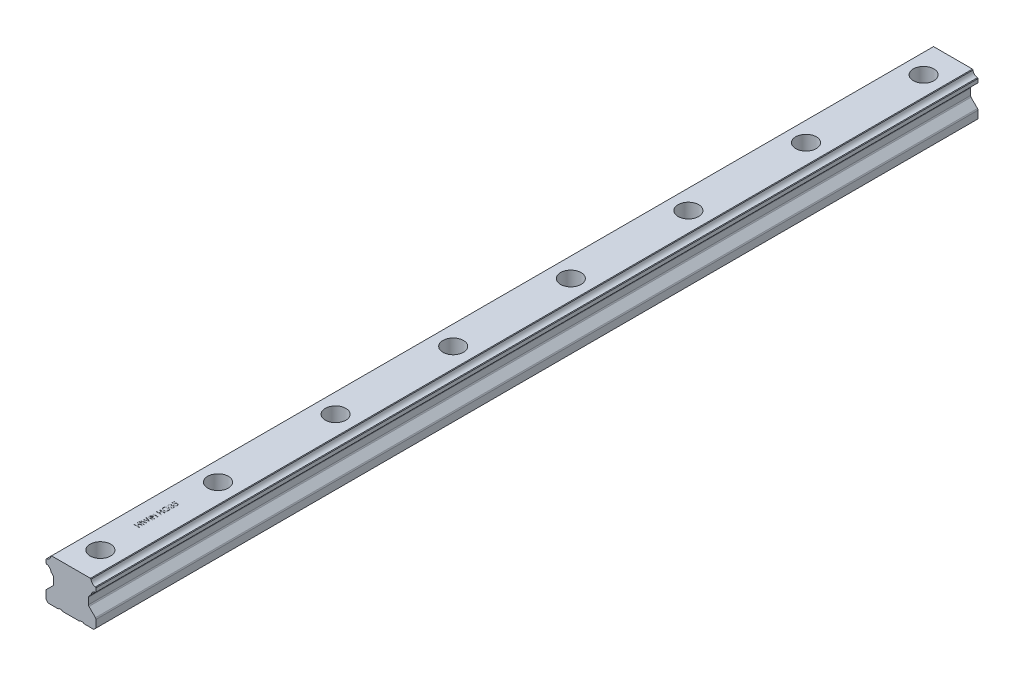
from build123d import *

# Parameters (mm, degrees)
EXTRUDE_1_DEPTH              = 600
HOLE_WIZARD_M8_1_D           = 9
HOLE_WIZARD_M8_1_CBORE_D     = 14
HOLE_WIZARD_M8_1_CBORE_DEPTH = 12
PATTERN_LINEAR_1_COUNT       = 8
PATTERN_LINEAR_1_PITCH       = 80
SKETCH_6_W                   = 3.5
SKETCH_6_H                   = 0.314102564
CUT_EXTRUDE_1_DEPTH          = 0.1


with BuildPart() as part:
    # 草图1 → 凸台-拉伸1 (new body)
    with BuildSketch(Plane.XY):
        with BuildLine():
            Line((-12.251471863, 11.889929766), (-16.648528137, 7.492873491))
            ThreePointArc((-16.648528137, 7.492873491), (-16.908655439, 7.103565472), (-17, 6.644345353))
            Line((-17, 6.644345353), (-17, 1.5))
            Line((-17, 1.5), (-15.5, 0))
            Line((-15.5, 0), (-8.75, 0))
            Line((-8.75, 0), (-8.25, 0.5))
            Line((-8.25, 0.5), (-6.35, 0.5))
            Line((-6.35, 0.5), (-5.85, 0))
            Line((-5.85, 0), (5.85, 0))
            Line((5.85, 0), (6.35, 0.5))
            Line((6.35, 0.5), (8.25, 0.5))
            Line((8.25, 0.5), (8.75, 0))
            Line((8.75, 0), (15.5, 0))
            Line((15.5, 0), (17, 1.5))
            Line((17, 1.5), (17, 6.644345353))
            ThreePointArc((17, 6.644345353), (16.908655439, 7.103565472), (16.648528137, 7.492873491))
            Line((16.648528137, 7.492873491), (12.251471863, 11.889929766))
            ThreePointArc((12.251471863, 11.889929766), (11.991344561, 12.279237784), (11.9, 12.738457903))
            Line((11.9, 12.738457903), (11.9, 17.141522369))
            ThreePointArc((11.9, 17.141522369), (11.991344561, 17.600742488), (12.251471863, 17.990050506))
            Line((12.251471863, 17.990050506), (13.625943381, 19.364522025))
            ThreePointArc((13.625943381, 19.364522025), (14.569476554, 21.429523446), (16.634477975, 22.373056619))
            Line((16.634477975, 22.373056619), (17, 22.738578644))
            Line((17, 22.738578644), (17, 25.251421356))
            Line((17, 25.251421356), (16.622602149, 25.628819207))
            ThreePointArc((16.622602149, 25.628819207), (14.569476554, 26.571476554), (13.626819207, 28.624602149))
            Line((13.626819207, 28.624602149), (13.251421356, 29))
            Line((13.251421356, 29), (-13.251421356, 29))
            Line((-13.251421356, 29), (-13.626819207, 28.624602149))
            ThreePointArc((-13.626819207, 28.624602149), (-14.569476554, 26.571476554), (-16.622602149, 25.628819207))
            Line((-16.622602149, 25.628819207), (-17, 25.251421356))
            Line((-17, 25.251421356), (-17, 22.738578644))
            Line((-17, 22.738578644), (-16.634477975, 22.373056619))
            ThreePointArc((-16.634477975, 22.373056619), (-14.569476554, 21.429523446), (-13.625943381, 19.364522025))
            Line((-13.625943381, 19.364522025), (-12.251471863, 17.990050506))
            ThreePointArc((-12.251471863, 17.990050506), (-11.991344561, 17.600742488), (-11.9, 17.141522369))
            Line((-11.9, 17.141522369), (-11.9, 12.738457903))
            ThreePointArc((-11.9, 12.738457903), (-11.991344561, 12.279237784), (-12.251471863, 11.889929766))
        make_face()
    extrude(amount=-EXTRUDE_1_DEPTH)

    # M8 六角凹头螺钉的柱形沉头孔1 (through all)
    with Locations(Plane(origin=(-5.47708742, 29, -56.116248257), x_dir=(-1, 0, 0), z_dir=(0, 1, 0))):
        with Locations((-5.47708742, 36.116248257)):
            hole_wizard_m8_1 = CounterBoreHole(HOLE_WIZARD_M8_1_D / 2, HOLE_WIZARD_M8_1_CBORE_D / 2, HOLE_WIZARD_M8_1_CBORE_DEPTH)

    # 阵列(线性)1: M8 六角凹头螺钉的柱形沉头孔1 ×8
    with Locations(*[(0, 0, -i * PATTERN_LINEAR_1_PITCH) for i in range(1, PATTERN_LINEAR_1_COUNT)]):
        add(hole_wizard_m8_1, mode=Mode.SUBTRACT)

    # 草图6 → 切除-拉伸1 (cut)
    with BuildSketch(Plane(origin=(0, 29, 0), x_dir=(1, 0, 0), z_dir=(0, 1, 0))):
        Polygon((-3.5, 46.403846154), (-3.5, 46.717948718), (-2.064102564, 46.717948718), (-2.064102564, 48.512820513), (-3.5, 48.512820513), (-3.5, 48.826923077), (0, 48.826923077), (0, 48.512820513), (-1.705128205, 48.512820513), (-1.705128205, 46.717948718), (0, 46.717948718), (0, 46.403846154), align=None)
        with Locations((-1.75, 49.881410256)):
            Rectangle(SKETCH_6_W, SKETCH_6_H)
        Polygon((-3.5, 50.576923077), (-3.5, 50.901542468), (-0.933193109, 51.586538462), (-3.5, 52.605268429), (-3.5, 52.650841346), (-0.950721154, 53.650641026), (-3.5, 54.339142628), (-3.5, 54.66025641), (0, 53.716546474), (0, 53.671674679), (-2.676883013, 52.618589744), (0, 51.552884615), (0, 51.508012821), align=None)
        with Locations((-1.75, 55.625)):
            Rectangle(SKETCH_6_W, SKETCH_6_H)
        Polygon((0, 56.544871795), (-3.5, 56.544871795), (-3.5, 56.610777244), (-0.745292468, 58.923076923), (-3.5, 58.923076923), (-3.5, 59.237179487), (0, 59.237179487), (0, 59.165665064), (-2.748397436, 56.858974359), (0, 56.858974359), align=None)
        Polygon((-3.5, 61.480769231), (-3.5, 61.794871795), (-2.064102564, 61.794871795), (-2.064102564, 63.58974359), (-3.5, 63.58974359), (-3.5, 63.903846154), (0, 63.903846154), (0, 63.58974359), (-1.705128205, 63.58974359), (-1.705128205, 61.794871795), (0, 61.794871795), (0, 61.480769231), align=None)
        with BuildLine():
            Line((-2.902644231, 68.076923077), (-2.647435897, 67.807692308))
            add(Edge.make_bspline(
                [(-2.647435897, 67.807692308), (-2.69328212, 67.758983227), (-2.783881335, 67.662726562), (-2.901244074, 67.50552662), (-3.002777003, 67.342170767), (-3.084772592, 67.172394867), (-3.149094254, 67.000650867), (-3.195850217, 66.829891913), (-3.225460377, 66.661223615), (-3.229016796, 66.549059313), (-3.230769231, 66.493790064)],
                knots=[0, 0, 0, 0, 1.089067066, 2.152164705, 3.18986567, 4.218445106, 5.218487318, 6.173592265, 7.100032889, 8, 8, 8, 8], degree=3))
            add(Edge.make_bspline(
                [(-3.230769231, 66.493790064), (-3.230355625, 66.459875364), (-3.229529486, 66.392133924), (-3.218985271, 66.29151198), (-3.203820407, 66.191945342), (-3.181878529, 66.093621968), (-3.15406947, 65.99635068), (-3.119284004, 65.900469793), (-3.078728771, 65.805800421), (-3.031866252, 65.713234402), (-2.980386575, 65.623493669), (-2.923337414, 65.538737672), (-2.862550889, 65.458421211), (-2.796491613, 65.384072004), (-2.725807311, 65.31519549), (-2.651770944, 65.250524789), (-2.572926872, 65.191265211), (-2.489599321, 65.138479571), (-2.403726867, 65.090811977), (-2.316037795, 65.049619777), (-2.227346143, 65.013809823), (-2.136984078, 64.986535862), (-2.045883197, 64.963434988), (-1.953566086, 64.947353752), (-1.859791669, 64.938257435), (-1.796993971, 64.936686944), (-1.765424679, 64.935897436)],
                knots=[0, 0, 0, 0, 1.028150113, 2.053633673, 3.06513288, 4.081487945, 5.106702018, 6.131327874, 7.172780699, 8.228344599, 9.276313556, 10.308389736, 11.324843658, 12.329040066, 13.321460474, 14.316307835, 15.308626991, 16.309440696, 17.305625405, 18.28535951, 19.246194545, 20.203493668, 21.145557131, 22.095268976, 23.042464743, 24, 24, 24, 24], degree=3))
            add(Edge.make_bspline(
                [(-1.765424679, 64.935897436), (-1.733154018, 64.936653631), (-1.668700816, 64.938163957), (-1.572504414, 64.947817154), (-1.477747832, 64.965772364), (-1.384282029, 64.989584114), (-1.291920993, 65.019856789), (-1.20076111, 65.057049303), (-1.110811241, 65.101355435), (-1.022964324, 65.152526704), (-0.937464192, 65.209036172), (-0.856251713, 65.271187356), (-0.780271995, 65.339084893), (-0.708415252, 65.411483836), (-0.641134974, 65.489043832), (-0.579242122, 65.572517364), (-0.521779643, 65.660735956), (-0.469378807, 65.753738745), (-0.42257144, 65.850542725), (-0.38094723, 65.949799156), (-0.346667976, 66.051827058), (-0.31872985, 66.156089724), (-0.295829559, 66.262463002), (-0.281097077, 66.371486803), (-0.270406246, 66.482359512), (-0.269624576, 66.557098144), (-0.269230769, 66.594751603)],
                knots=[0, 0, 0, 0, 0.935915162, 1.869274651, 2.799799983, 3.730201895, 4.664668062, 5.616159355, 6.583070886, 7.570012957, 8.562524459, 9.553461134, 10.53281078, 11.515274572, 12.509912756, 13.507571325, 14.526460018, 15.561318395, 16.601025881, 17.643204557, 18.680545676, 19.719612342, 20.772381578, 21.833430283, 22.908478249, 24, 24, 24, 24], degree=3))
            add(Edge.make_bspline(
                [(-0.269230769, 66.594751603), (-0.270178952, 66.640130135), (-0.272040863, 66.729238255), (-0.286546735, 66.860222075), (-0.309173205, 66.986034693), (-0.342412256, 67.106266531), (-0.384484705, 67.221353926), (-0.436513285, 67.330872414), (-0.497950569, 67.435124408), (-0.567552463, 67.533658668), (-0.645100929, 67.624132689), (-0.728035637, 67.706474768), (-0.817431068, 67.77785339), (-0.911954918, 67.840400707), (-1.012511326, 67.892097951), (-1.118540888, 67.934543829), (-1.230109213, 67.967076285), (-1.307200733, 67.980431374), (-1.346153846, 67.987179487)],
                knots=[0, 0, 0, 0, 1.130199668, 2.219330667, 3.279027493, 4.311506524, 5.322739849, 6.327972234, 7.327472899, 8.33386792, 9.329086447, 10.29244429, 11.240784345, 12.174119183, 13.111530729, 14.052100829, 15.015757696, 16, 16, 16, 16], degree=3))
            Line((-1.346153846, 67.987179487), (-1.346153846, 66.820512821))
            Line((-1.346153846, 66.820512821), (-1.705128205, 66.820512821))
            Line((-1.705128205, 66.820512821), (-1.705128205, 68.301282051))
            add(Edge.make_bspline(
                [(-1.705128205, 68.301282051), (-1.638220716, 68.299576203), (-1.507270675, 68.296237549), (-1.316300404, 68.272818634), (-1.13592871, 68.235002122), (-0.965965639, 68.18334181), (-0.806652046, 68.116466529), (-0.65782618, 68.035094001), (-0.520449499, 67.93792188), (-0.393400495, 67.828411438), (-0.280071283, 67.705511481), (-0.180465345, 67.572542861), (-0.09656273, 67.429285892), (-0.028302067, 67.275876085), (0.024971927, 67.112815651), (0.062743504, 66.939727272), (0.085373467, 66.756845671), (0.088264847, 66.631508994), (0.08974359, 66.567407853)],
                knots=[0, 0, 0, 0, 1.140356446, 2.231883559, 3.274166699, 4.278491846, 5.25512956, 6.21435461, 7.1637429, 8.11826594, 9.068280886, 10.0076534, 10.945064095, 11.891975133, 12.864533718, 13.863980011, 14.907571808, 16, 16, 16, 16], degree=3))
            add(Edge.make_bspline(
                [(0.08974359, 66.567407853), (0.089174469, 66.527897717), (0.088051978, 66.449970996), (0.080074631, 66.334880068), (0.067794054, 66.222962448), (0.049248931, 66.114234439), (0.026534277, 66.008296097), (-0.002552442, 65.905676512), (-0.036221141, 65.80598477), (-0.074516815, 65.709066784), (-0.118888472, 65.615802237), (-0.168198111, 65.52577572), (-0.222191472, 65.438489595), (-0.281802318, 65.35453843), (-0.346584778, 65.273484808), (-0.416668697, 65.195851364), (-0.491839816, 65.121203486), (-0.545218826, 65.074443023), (-0.572115385, 65.05088141)],
                knots=[0, 0, 0, 0, 1.107784379, 2.184907829, 3.233506516, 4.263428166, 5.276301166, 6.270063455, 7.25232949, 8.225834625, 9.190232166, 10.146266622, 11.1027726, 12.066435141, 13.031522626, 14.010570082, 14.99756817, 16, 16, 16, 16], degree=3))
            add(Edge.make_bspline(
                [(-0.572115385, 65.05088141), (-0.614786038, 65.016695478), (-0.699419055, 64.948891066), (-0.835018999, 64.861612909), (-0.975420859, 64.787211506), (-1.121015488, 64.726843684), (-1.271666701, 64.679705598), (-1.427181992, 64.645899345), (-1.587761622, 64.626092056), (-1.696426887, 64.623238518), (-1.751402244, 64.621794872)],
                knots=[0, 0, 0, 0, 1.023165419, 2.029347347, 3.013907458, 3.994755782, 4.975994455, 5.96558838, 6.970761222, 8, 8, 8, 8], degree=3))
            add(Edge.make_bspline(
                [(-1.751402244, 64.621794872), (-1.792568496, 64.62232711), (-1.874377804, 64.623384821), (-1.99583511, 64.636210339), (-2.115135808, 64.654611751), (-2.232182344, 64.681658827), (-2.347053012, 64.715755013), (-2.45980069, 64.758308794), (-2.570493643, 64.807852572), (-2.67836343, 64.865442289), (-2.782003044, 64.929511026), (-2.880905313, 64.999118682), (-2.973467332, 65.074802367), (-3.059903521, 65.156782462), (-3.141494975, 65.243406392), (-3.216537375, 65.336492693), (-3.286205011, 65.434631029), (-3.349159221, 65.538582169), (-3.405727075, 65.6467058), (-3.455315154, 65.758766886), (-3.496298775, 65.874724704), (-3.531072472, 65.993712261), (-3.556787635, 66.11662974), (-3.575436374, 66.242585283), (-3.588196976, 66.372235393), (-3.589223231, 66.459871423), (-3.58974359, 66.504306891)],
                knots=[0, 0, 0, 0, 1.00895651, 2.005089799, 2.991467152, 3.967318338, 4.948153826, 5.927364234, 6.919980553, 7.91976625, 8.923240147, 9.905815003, 10.88314567, 11.851989312, 12.825009789, 13.798721852, 14.781296708, 15.773896486, 16.776076962, 17.771600213, 18.775744723, 19.78957137, 20.808953803, 21.851964491, 22.910847925, 24, 24, 24, 24], degree=3))
            add(Edge.make_bspline(
                [(-3.58974359, 66.504306891), (-3.589164098, 66.540545135), (-3.588015034, 66.612401313), (-3.580050386, 66.719327046), (-3.567426505, 66.82460006), (-3.550199718, 66.92837645), (-3.526736028, 67.030302816), (-3.498657743, 67.130669522), (-3.46596592, 67.229622058), (-3.426977074, 67.326850307), (-3.382723449, 67.423008023), (-3.332910027, 67.518629864), (-3.276685022, 67.61338911), (-3.213881487, 67.707450091), (-3.145578069, 67.801405949), (-3.069821245, 67.893770591), (-2.989598489, 67.986773536), (-2.931916305, 68.04657535), (-2.902644231, 68.076923077)],
                knots=[0, 0, 0, 0, 0.985871117, 1.954866573, 2.915460327, 3.869826059, 4.81536089, 5.759505086, 6.70452669, 7.649098992, 8.607881297, 9.583363685, 10.581137262, 11.603961102, 12.659522466, 13.73993555, 14.853081303, 16, 16, 16, 16], degree=3))
        make_face()
        with BuildLine():
            Line((-2.692307692, 69.153846154), (-2.692307692, 68.83974359))
            add(Edge.make_bspline(
                [(-2.692307692, 68.83974359), (-2.727540176, 68.84825314), (-2.796416801, 68.864888616), (-2.894824062, 68.899586189), (-2.987947583, 68.937385445), (-3.074043657, 68.982774549), (-3.154842559, 69.032283303), (-3.228511684, 69.089006025), (-3.296924649, 69.150325748), (-3.357637887, 69.218150697), (-3.412615616, 69.289279358), (-3.459490673, 69.364713978), (-3.499814826, 69.442936872), (-3.533035058, 69.524490005), (-3.558060582, 69.609616177), (-3.576217387, 69.6975458), (-3.588008502, 69.7885093), (-3.589159265, 69.850256891), (-3.58974359, 69.881610577)],
                knots=[0, 0, 0, 0, 1.162005537, 2.271625781, 3.343758855, 4.383309926, 5.390229558, 6.379919256, 7.361854164, 8.333198761, 9.295911338, 10.242430842, 11.177959212, 12.116337295, 13.062827104, 14.020064771, 14.994644689, 16, 16, 16, 16], degree=3))
            add(Edge.make_bspline(
                [(-3.58974359, 69.881610577), (-3.588364359, 69.927293319), (-3.585635984, 70.01766233), (-3.560721548, 70.150425377), (-3.521296415, 70.278452196), (-3.466822688, 70.400341444), (-3.399635375, 70.513559876), (-3.319670638, 70.614296063), (-3.228471337, 70.701184574), (-3.127738772, 70.774078952), (-3.020083263, 70.831153951), (-2.909283106, 70.873240324), (-2.795601134, 70.898862005), (-2.718843855, 70.902182562), (-2.680388622, 70.903846154)],
                knots=[0, 0, 0, 0, 1.083050992, 2.142477498, 3.193116406, 4.255571735, 5.30263384, 6.308962982, 7.297363603, 8.282367274, 9.249857812, 10.179914175, 11.08814088, 12, 12, 12, 12], degree=3))
            add(Edge.make_bspline(
                [(-2.680388622, 70.903846154), (-2.643381827, 70.902682563), (-2.570965273, 70.900405596), (-2.465243775, 70.88107189), (-2.365602175, 70.848535627), (-2.271621013, 70.803465865), (-2.183896173, 70.745124314), (-2.102230282, 70.674451618), (-2.026261124, 70.590948956), (-1.982741651, 70.527670018), (-1.960336538, 70.495092147)],
                knots=[0, 0, 0, 0, 1.024540389, 2.004866551, 2.965041327, 3.920577974, 4.882998113, 5.874504559, 6.905732034, 8, 8, 8, 8], degree=3))
            add(Edge.make_bspline(
                [(-1.960336538, 70.495092147), (-1.942423541, 70.532371359), (-1.906875194, 70.606351961), (-1.836051735, 70.706173383), (-1.75628694, 70.79817187), (-1.693344586, 70.848874652), (-1.661658654, 70.874399038)],
                knots=[0, 0, 0, 0, 1.015663554, 2.015584519, 3.001021554, 4, 4, 4, 4], degree=3))
            add(Edge.make_bspline(
                [(-1.661658654, 70.874399038), (-1.638600902, 70.891240381), (-1.592862986, 70.924647277), (-1.51932656, 70.965882811), (-1.444975071, 71.003291925), (-1.367815664, 71.032442144), (-1.288742651, 71.055016011), (-1.207620255, 71.071152043), (-1.124382232, 71.081176184), (-1.068069752, 71.082611736), (-1.039763622, 71.083333333)],
                knots=[0, 0, 0, 0, 1.025084078, 2.033381695, 3.024893161, 4.013698104, 4.991890475, 5.976764909, 6.982997093, 8, 8, 8, 8], degree=3))
            add(Edge.make_bspline(
                [(-1.039763622, 71.083333333), (-0.990754151, 71.081538561), (-0.892965849, 71.077957463), (-0.74848737, 71.045957268), (-0.60727652, 70.996328902), (-0.47214511, 70.925930361), (-0.345832955, 70.839746222), (-0.231982837, 70.738346794), (-0.135655914, 70.620282446), (-0.054197152, 70.489832037), (0.01031173, 70.347893086), (0.056807387, 70.196698141), (0.084695443, 70.037122187), (0.088041716, 69.927996169), (0.08974359, 69.872495994)],
                knots=[0, 0, 0, 0, 0.955697303, 1.906897079, 2.875188111, 3.870982192, 4.871999088, 5.854111427, 6.836107184, 7.836239895, 8.848948182, 9.870701427, 10.917064451, 12, 12, 12, 12], degree=3))
            add(Edge.make_bspline(
                [(0.08974359, 69.872495994), (0.088867804, 69.835079049), (0.087144549, 69.761454978), (0.075573795, 69.653177935), (0.053866216, 69.550041451), (0.02656593, 69.45104403), (-0.011179774, 69.357679783), (-0.056179646, 69.268605754), (-0.109587649, 69.184212384), (-0.171493598, 69.105000859), (-0.240788051, 69.031055805), (-0.318622183, 68.964261099), (-0.403543338, 68.903877726), (-0.496315397, 68.850289356), (-0.596678518, 68.803270455), (-0.705034874, 68.763832876), (-0.820544439, 68.729398997), (-0.901018589, 68.713358268), (-0.942307692, 68.705128205)],
                knots=[0, 0, 0, 0, 1.048603596, 2.063302207, 3.045874044, 3.999447474, 4.937100059, 5.862643889, 6.7929026, 7.7308982, 8.676022965, 9.627908155, 10.600123445, 11.591992905, 12.626222643, 13.701663232, 14.820785756, 16, 16, 16, 16], degree=3))
            Line((-0.942307692, 68.705128205), (-0.942307692, 69.019230769))
            add(Edge.make_bspline(
                [(-0.942307692, 69.019230769), (-0.915358679, 69.027414061), (-0.862940507, 69.043331273), (-0.787500202, 69.070425571), (-0.718342149, 69.101293843), (-0.654959027, 69.134408402), (-0.596726624, 69.169186848), (-0.545184755, 69.208101773), (-0.498069553, 69.248270918), (-0.471524941, 69.278550272), (-0.458533654, 69.293369391)],
                knots=[0, 0, 0, 0, 1.198163088, 2.33053128, 3.407730985, 4.417276592, 5.372219308, 6.28897303, 7.162600585, 8, 8, 8, 8], degree=3))
            add(Edge.make_bspline(
                [(-0.458533654, 69.293369391), (-0.44343155, 69.312968156), (-0.413273959, 69.35210519), (-0.374678832, 69.415840572), (-0.341642326, 69.48310519), (-0.31478887, 69.554459985), (-0.294631697, 69.629914528), (-0.280123513, 69.709162744), (-0.270545857, 69.792334659), (-0.269675525, 69.849097866), (-0.269230769, 69.878104968)],
                knots=[0, 0, 0, 0, 0.946083416, 1.889246487, 2.84504177, 3.809995578, 4.801312957, 5.829064617, 6.89060985, 8, 8, 8, 8], degree=3))
            add(Edge.make_bspline(
                [(-0.269230769, 69.878104968), (-0.269846674, 69.910858471), (-0.271051024, 69.974905118), (-0.282126731, 70.068359977), (-0.298257144, 70.157267424), (-0.323170127, 70.24064035), (-0.353950979, 70.319570858), (-0.392599384, 70.392952507), (-0.437944106, 70.461748613), (-0.489483264, 70.525078019), (-0.545904759, 70.582023526), (-0.60491783, 70.63216304), (-0.66627366, 70.674787701), (-0.730311781, 70.709171279), (-0.79676701, 70.736321829), (-0.865825839, 70.75480503), (-0.936923105, 70.767656545), (-0.985252074, 70.768703157), (-1.009615385, 70.769230769)],
                knots=[0, 0, 0, 0, 1.217147791, 2.380027433, 3.494444702, 4.572153297, 5.609568379, 6.639424714, 7.649109417, 8.668170816, 9.669597737, 10.625200337, 11.543417969, 12.441394052, 13.322311151, 14.205496177, 15.095365482, 16, 16, 16, 16], degree=3))
            add(Edge.make_bspline(
                [(-1.009615385, 70.769230769), (-1.042224638, 70.767697248), (-1.107280885, 70.764637835), (-1.2030297, 70.741377488), (-1.295316283, 70.702773106), (-1.38294536, 70.649787861), (-1.463170576, 70.583711244), (-1.535262402, 70.50766728), (-1.594692546, 70.419587186), (-1.635791228, 70.338580334), (-1.663826853, 70.266813294), (-1.68250216, 70.205398354), (-1.698315711, 70.136641615), (-1.713028014, 70.061375308), (-1.725549353, 69.979032079), (-1.735991171, 69.889701645), (-1.744346211, 69.793365882), (-1.748077307, 69.726674716), (-1.75, 69.692307692)],
                knots=[0, 0, 0, 0, 1.070505987, 2.135685285, 3.216438728, 4.346150463, 5.486482244, 6.621737109, 7.7759408, 8.963942283, 9.59839197, 10.305095457, 11.070459627, 11.915156775, 12.823989992, 13.805807174, 14.869297358, 16, 16, 16, 16], degree=3))
            Line((-1.75, 69.692307692), (-2.108974359, 69.692307692))
            add(Edge.make_bspline(
                [(-2.108974359, 69.692307692), (-2.109815076, 69.73559321), (-2.111461258, 69.820349257), (-2.127376172, 69.944483988), (-2.152925868, 70.062682625), (-2.189431972, 70.173246032), (-2.232431754, 70.273826023), (-2.282116815, 70.361437758), (-2.338352279, 70.433774821), (-2.400061459, 70.49159294), (-2.465885585, 70.535538773), (-2.534911696, 70.567143345), (-2.607413433, 70.585979698), (-2.65691109, 70.588484541), (-2.681790865, 70.58974359)],
                knots=[0, 0, 0, 0, 1.322091412, 2.58874672, 3.817242262, 5.011895168, 6.140903042, 7.155122731, 8.080855046, 8.929742606, 9.727943956, 10.488587771, 11.240295418, 12, 12, 12, 12], degree=3))
            add(Edge.make_bspline(
                [(-2.681790865, 70.58974359), (-2.700071652, 70.589338248), (-2.73644041, 70.58853184), (-2.789741053, 70.577957798), (-2.841409956, 70.562798788), (-2.890858006, 70.540789728), (-2.938186405, 70.512273586), (-2.983914344, 70.477877516), (-3.027450953, 70.436621217), (-3.069020841, 70.390413715), (-3.106837935, 70.339246935), (-3.13993415, 70.284314422), (-3.168009957, 70.225838922), (-3.191238499, 70.16419501), (-3.208692545, 70.09909542), (-3.221229855, 70.03087), (-3.229067101, 69.959382), (-3.230195574, 69.910610312), (-3.230769231, 69.885817308)],
                knots=[0, 0, 0, 0, 0.884325644, 1.759323928, 2.622595547, 3.489424008, 4.37295195, 5.294616785, 6.255907374, 7.274251867, 8.302369084, 9.333474657, 10.37669385, 11.44084034, 12.520297356, 13.637342342, 14.798947025, 16, 16, 16, 16], degree=3))
            add(Edge.make_bspline(
                [(-3.230769231, 69.885817308), (-3.229377869, 69.84596564), (-3.226660215, 69.768126063), (-3.202857202, 69.655911146), (-3.164879118, 69.551591812), (-3.119546099, 69.471853146), (-3.074795665, 69.412970572), (-3.035713279, 69.370893633), (-2.992280455, 69.329573123), (-2.94182208, 69.291727446), (-2.887755289, 69.25345347), (-2.827331608, 69.218608908), (-2.762127214, 69.184749216), (-2.716031579, 69.164346666), (-2.692307692, 69.153846154)],
                knots=[0, 0, 0, 0, 1.472543308, 2.876219568, 4.221790263, 5.565193594, 6.249813518, 6.953379497, 7.687249741, 8.463570142, 9.283606569, 10.136032583, 11.040678096, 12, 12, 12, 12], degree=3))
        make_face()
        with BuildLine():
            Line((-3.5, 73.596153846), (-3.141025641, 73.596153846))
            Line((-3.141025641, 73.596153846), (-3.141025641, 72.405649038))
            Line((-3.141025641, 72.405649038), (-2.220452724, 72.217047276))
            add(Edge.make_bspline(
                [(-2.220452724, 72.217047276), (-2.230682996, 72.25410315), (-2.25050253, 72.325893046), (-2.2725083, 72.431852907), (-2.285773744, 72.53244511), (-2.287585055, 72.597720481), (-2.288461538, 72.629306891)],
                knots=[0, 0, 0, 0, 1.100273476, 2.13160584, 3.095893838, 4, 4, 4, 4], degree=3))
            add(Edge.make_bspline(
                [(-2.288461538, 72.629306891), (-2.28764354, 72.668397805), (-2.28603515, 72.745260309), (-2.269673986, 72.857544614), (-2.245976174, 72.96527195), (-2.209465207, 73.066851732), (-2.164878805, 73.163891055), (-2.108721258, 73.254723386), (-2.04315746, 73.34062356), (-1.968525078, 73.420997879), (-1.885534459, 73.493570878), (-1.795933934, 73.556634421), (-1.701678739, 73.611677196), (-1.600559725, 73.654605621), (-1.494484031, 73.689639403), (-1.382227183, 73.712740767), (-1.264785773, 73.728171477), (-1.18448027, 73.729891917), (-1.143529647, 73.730769231)],
                knots=[0, 0, 0, 0, 1.052805225, 2.070078116, 3.052532748, 4.020689046, 4.973125432, 5.925915817, 6.89216474, 7.881560752, 8.877013184, 9.857446635, 10.830895175, 11.812622661, 12.812548702, 13.836681939, 14.896847428, 16, 16, 16, 16], degree=3))
            add(Edge.make_bspline(
                [(-1.143529647, 73.730769231), (-1.115007605, 73.730103556), (-1.058348972, 73.728781204), (-0.974202158, 73.7220714), (-0.891849045, 73.709103007), (-0.811440613, 73.69190289), (-0.732901554, 73.668941583), (-0.65579213, 73.642084161), (-0.580956685, 73.608702163), (-0.508064701, 73.571694489), (-0.437950402, 73.530715464), (-0.372294905, 73.484635462), (-0.309599937, 73.436755685), (-0.251727444, 73.384438189), (-0.198452948, 73.328277796), (-0.149513072, 73.268586987), (-0.104029493, 73.205907167), (-0.063861909, 73.139251137), (-0.026898788, 73.070108867), (0.003424705, 72.997480593), (0.030535245, 72.923019908), (0.05214477, 72.845655028), (0.069077325, 72.765561217), (0.080577925, 72.682606441), (0.088954363, 72.597225771), (0.08947872, 72.539350758), (0.08974359, 72.510116186)],
                knots=[0, 0, 0, 0, 1.056393913, 2.098511576, 3.122979385, 4.141471433, 5.141222888, 6.151259816, 7.162667642, 8.172852865, 9.177685681, 10.166741883, 11.141342384, 12.097242845, 13.052202613, 14.005160326, 14.953864445, 15.917140761, 16.884916217, 17.854238259, 18.828761908, 19.81781811, 20.826036654, 21.857789401, 22.917898972, 24, 24, 24, 24], degree=3))
            add(Edge.make_bspline(
                [(0.08974359, 72.510116186), (0.089050894, 72.475242894), (0.087688097, 72.406633813), (0.073496095, 72.30610057), (0.053035464, 72.209432256), (0.022721931, 72.117043177), (-0.016971483, 72.029318648), (-0.064133263, 71.945002475), (-0.12027864, 71.865139718), (-0.184894072, 71.790276377), (-0.255892818, 71.721460371), (-0.332202561, 71.65905751), (-0.413920487, 71.604193873), (-0.500780871, 71.556670445), (-0.592629648, 71.516184815), (-0.689749822, 71.484366409), (-0.791650601, 71.45868899), (-0.861804004, 71.447825441), (-0.897435897, 71.442307692)],
                knots=[0, 0, 0, 0, 1.046872515, 2.059598001, 3.044168548, 4.012104806, 4.973680974, 5.932408326, 6.910122221, 7.900780896, 8.89867654, 9.876692837, 10.858029398, 11.85084981, 12.847361615, 13.868568023, 14.917415949, 16, 16, 16, 16], degree=3))
            Line((-0.897435897, 71.442307692), (-0.897435897, 71.756410256))
            add(Edge.make_bspline(
                [(-0.897435897, 71.756410256), (-0.86405597, 71.764133979), (-0.799897896, 71.778979402), (-0.709812799, 71.811649494), (-0.62950762, 71.851206459), (-0.558491359, 71.899340396), (-0.495464081, 71.955133792), (-0.43989307, 72.019990731), (-0.389697273, 72.092289811), (-0.347784769, 72.17267219), (-0.312479137, 72.257640252), (-0.287283878, 72.346063351), (-0.272032646, 72.436668904), (-0.270168243, 72.497671524), (-0.269230769, 72.528345353)],
                knots=[0, 0, 0, 0, 1.13623081, 2.183898708, 3.172478118, 4.09966615, 5.022692284, 5.957376522, 6.927682873, 7.937366477, 8.960015386, 9.976409503, 10.982481913, 12, 12, 12, 12], degree=3))
            add(Edge.make_bspline(
                [(-0.269230769, 72.528345353), (-0.270058415, 72.558301256), (-0.271688055, 72.617284674), (-0.284028564, 72.704132513), (-0.303533592, 72.787735767), (-0.33085902, 72.868242843), (-0.367008958, 72.945258145), (-0.411417074, 73.018672781), (-0.462975425, 73.089532607), (-0.521904738, 73.1559727), (-0.586881759, 73.216808942), (-0.656357238, 73.270565902), (-0.730474586, 73.315342595), (-0.807947606, 73.353076763), (-0.889626199, 73.381730046), (-0.975127364, 73.402171031), (-1.064662347, 73.414174089), (-1.125731657, 73.415825269), (-1.156850962, 73.416666667)],
                knots=[0, 0, 0, 0, 1.027268864, 2.022700798, 3.002744649, 3.968653148, 4.933396556, 5.915045722, 6.907600446, 7.935526002, 8.956456544, 9.95700807, 10.942805781, 11.92166854, 12.907987664, 13.905483474, 14.932689774, 16, 16, 16, 16], degree=3))
            add(Edge.make_bspline(
                [(-1.156850962, 73.416666667), (-1.184930032, 73.416028195), (-1.239659043, 73.414783746), (-1.320009695, 73.404010642), (-1.396158478, 73.386014341), (-1.468436727, 73.360391264), (-1.536613353, 73.328412845), (-1.600538112, 73.288262971), (-1.660812066, 73.241651258), (-1.715884112, 73.187233139), (-1.766793088, 73.12803749), (-1.810034281, 73.062543866), (-1.846807397, 72.992500701), (-1.876936465, 72.917778197), (-1.900936575, 72.838284311), (-1.917523378, 72.753976228), (-1.92744867, 72.664834733), (-1.928795087, 72.603859089), (-1.929487179, 72.572516026)],
                knots=[0, 0, 0, 0, 1.045723156, 2.038222538, 3.013889863, 3.95567481, 4.890389958, 5.81331128, 6.76251276, 7.723027653, 8.692928204, 9.666105983, 10.639751036, 11.635719707, 12.66315958, 13.728667616, 14.832476222, 16, 16, 16, 16], degree=3))
            add(Edge.make_bspline(
                [(-1.929487179, 72.572516026), (-1.928906588, 72.545387097), (-1.927707815, 72.489372742), (-1.918881318, 72.403449915), (-1.904642024, 72.313158192), (-1.885055776, 72.218843696), (-1.859424699, 72.120223188), (-1.828710199, 72.017504787), (-1.7919882, 71.910472521), (-1.764255986, 71.838354796), (-1.75, 71.801282051)],
                knots=[0, 0, 0, 0, 0.817624296, 1.688186739, 2.600797293, 3.572016777, 4.590301741, 5.671205678, 6.80286297, 8, 8, 8, 8], degree=3))
            Line((-1.75, 71.801282051), (-3.5, 72.16025641))
            Line((-3.5, 72.16025641), (-3.5, 73.596153846))
        make_face()
    extrude(amount=-CUT_EXTRUDE_1_DEPTH, mode=Mode.SUBTRACT)


solid = part.part
